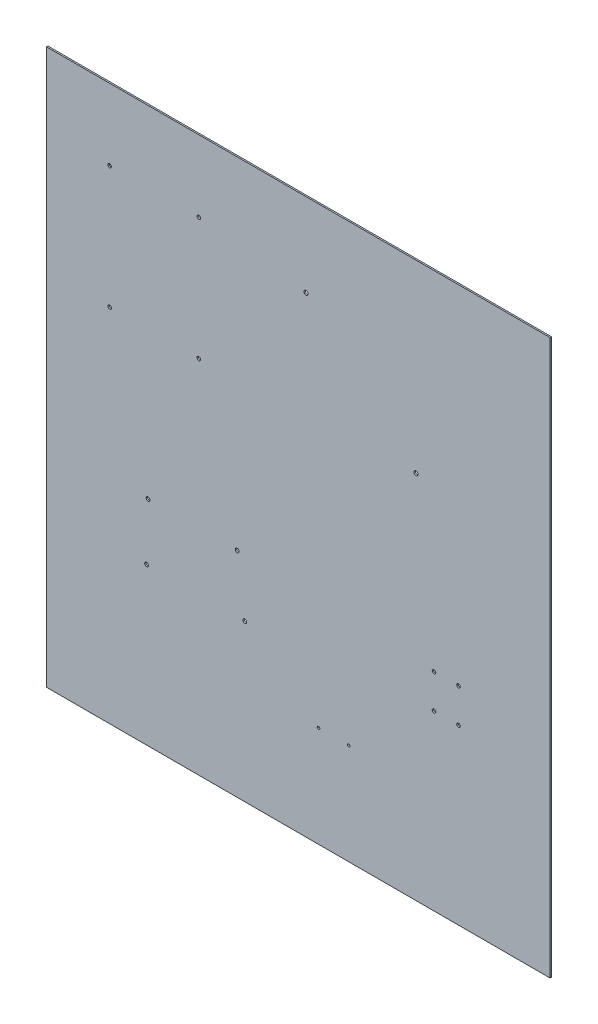
from build123d import *

# Parameters (mm, degrees)
ESQUISSE1_W             = 423
ESQUISSE1_H             = 466
BOSS_EXTRU_1_DEPTH      = 1.2
ESQUISSE2_R             = 1.5
ESQUISSE2_R_2           = 1.75
ESQUISSE2_R_3           = 1.6
ESQUISSE2_R_4           = 1.1
ENL_V_MAT_EXTRU_1_DEPTH = 1.2


with BuildPart() as part:
    # Esquisse1 → Boss.-Extru.1 (new body)
    with BuildSketch(Plane.XY):
        with Locations((148.96064521, -197.792747525)):
            Rectangle(ESQUISSE1_W, ESQUISSE1_H)
    extrude(amount=BOSS_EXTRU_1_DEPTH)

    # Esquisse2 → Enlèv. mat.-Extru.1 (cut)
    with BuildSketch(Plane.XY.offset(1.2)):
        with Locations((-9.53935479, -24.792747525)):
            Circle(ESQUISSE2_R)
        with Locations((65.39064521, -24.792747525)):
            Circle(ESQUISSE2_R)
        with Locations((65.39064521, -127.662747525)):
            Circle(ESQUISSE2_R)
        with Locations((-9.53935479, -127.662747525)):
            Circle(ESQUISSE2_R)
        with Locations((155.39064521, -34.792747525)):
            Circle(ESQUISSE2_R_2)
        with Locations((247.89064521, -119.792747525)):
            Circle(ESQUISSE2_R_2)
        with Locations((21.527784713, -299.35465218)):
            Circle(ESQUISSE2_R_3)
        with Locations((103.997784713, -299.35465218)):
            Circle(ESQUISSE2_R_3)
        with Locations((22.757784713, -251.13465218)):
            Circle(ESQUISSE2_R_3)
        with Locations((97.637784713, -251.13465218)):
            Circle(ESQUISSE2_R_3)
        with Locations((262.974763868, -256.697283378)):
            Circle(ESQUISSE2_R)
        with Locations((262.974763868, -285.297283378)):
            Circle(ESQUISSE2_R)
        with Locations((283.574763868, -285.297283378)):
            Circle(ESQUISSE2_R)
        with Locations((283.574763868, -256.697283378)):
            Circle(ESQUISSE2_R)
        with Locations((165.954341109, -346.08211118)):
            Circle(ESQUISSE2_R_4)
        with Locations((191.354341109, -346.08211118)):
            Circle(ESQUISSE2_R_4)
    extrude(amount=-ENL_V_MAT_EXTRU_1_DEPTH, mode=Mode.SUBTRACT)


solid = part.part
